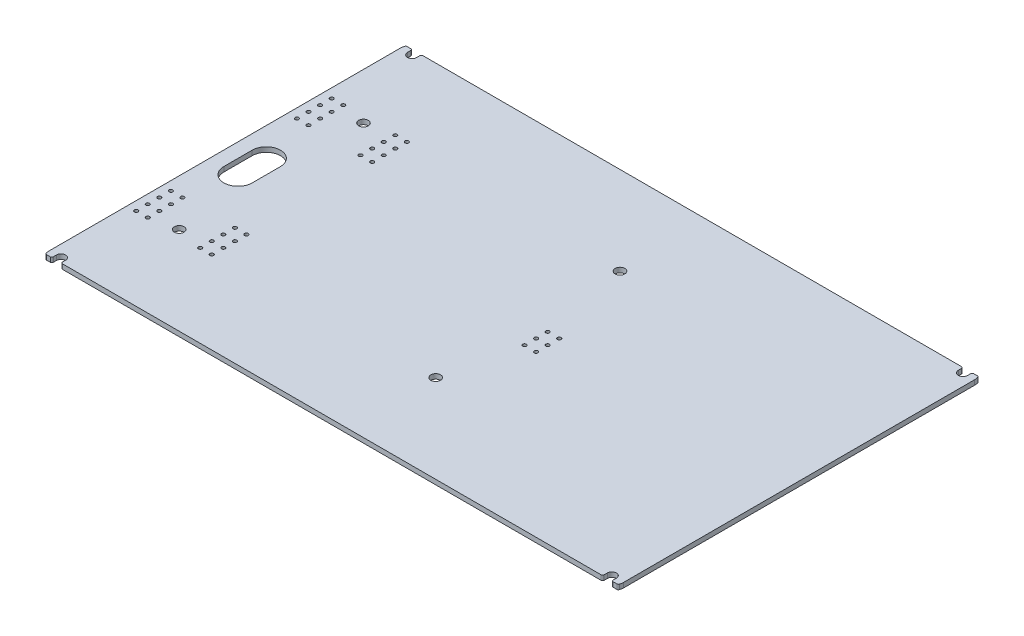
from build123d import *

# Parameters (mm, degrees)
BOSS_EXTRUDE1_DEPTH = 1.5875
SKETCH2_R           = 1.5875
CUT_EXTRUDE1_DEPTH  = 146.836682004
CUT_EXTRUDE2_DEPTH  = 146.836682004
SKETCH7_R           = 0.6
CUT_EXTRUDE3_DEPTH  = 146.836682004
CUT_EXTRUDE4_DEPTH  = 146.836682004
FILLET1_R           = 0.508


with BuildPart() as part:
    # Sketch1 → Boss-Extrude1 (new body)
    with BuildSketch(Plane(origin=(0, 0, 0), x_dir=(1, 0, 0), z_dir=(0, 1, 0))):
        with BuildLine():
            Line((-55.984338917, -57.8231), (-55.984338917, 57.8231))
            ThreePointArc((-55.984338917, 57.8231), (-55.902770541, 58.613831816), (-55.661500758, 59.371261083))
            Line((-55.661500758, 59.371261083), (132.872022924, 59.371261083))
            ThreePointArc((132.872022924, 59.371261083), (133.113292708, 58.613831816), (133.194861083, 57.8231))
            Line((133.194861083, 57.8231), (133.194861083, -57.8231))
            ThreePointArc((133.194861083, -57.8231), (133.113292708, -58.613831816), (132.872022924, -59.371261083))
            Line((132.872022924, -59.371261083), (-55.661500758, -59.371261083))
            ThreePointArc((-55.661500758, -59.371261083), (-55.902770541, -58.613831816), (-55.984338917, -57.8231))
        make_face()
    extrude(amount=-BOSS_EXTRUDE1_DEPTH)

    # Sketch2 → Cut-Extrude1 (cut, through all)
    with BuildSketch(Plane(origin=(0, 0, 0), x_dir=(1, 0, 0), z_dir=(0, 1, 0))):
        with Locations((-40.6725, -30.35)):
            Circle(SKETCH2_R)
        with Locations((-40.6725, 30.35)):
            Circle(SKETCH2_R)
        with Locations((43.8275, 30.35)):
            Circle(SKETCH2_R)
        with Locations((43.8275, -30.35)):
            Circle(SKETCH2_R)
    extrude(amount=-CUT_EXTRUDE1_DEPTH, mode=Mode.SUBTRACT)

    # Sketch3 → Cut-Extrude2 (cut, through all)
    with BuildSketch(Plane(origin=(0, 0, 0), x_dir=(1, 0, 0), z_dir=(0, 1, 0))):
        with BuildLine():
            Line((-41.933471413, 4.284952831), (-41.933471413, -5.034952831))
            ThreePointArc((-41.933471413, -5.034952831), (-46.603471413, -9.704952831), (-51.273471413, -5.034952831))
            Line((-51.273471413, -5.034952831), (-51.273471413, 4.284952831))
            ThreePointArc((-51.273471413, 4.284952831), (-46.603471413, 8.954952831), (-41.933471413, 4.284952831))
        make_face()
    extrude(amount=-CUT_EXTRUDE2_DEPTH, mode=Mode.SUBTRACT)

    # Sketch7 → Cut-Extrude3 (cut, through all)
    with BuildSketch(Plane.XZ.offset(1.5875)):
        with Locations((49.2175, 6.483)):
            Circle(SKETCH7_R)
        with Locations((-49.1085, -32.125)):
            Circle(SKETCH7_R)
        with Locations((-28.1535, -32.125)):
            Circle(SKETCH7_R)
        with Locations((-28.1535, 20.707)):
            Circle(SKETCH7_R)
        with Locations((-49.2355, 20.707)):
            Circle(SKETCH7_R)
        with Locations((-31.9635, 20.707)):
            Circle(SKETCH7_R)
        with Locations((-53.0455, 20.707)):
            Circle(SKETCH7_R)
        with Locations((-31.9635, 28.327)):
            Circle(SKETCH7_R)
        with Locations((-53.0455, 28.327)):
            Circle(SKETCH7_R)
        with Locations((-31.9635, 24.517)):
            Circle(SKETCH7_R)
        with Locations((-53.0455, 24.517)):
            Circle(SKETCH7_R)
        with Locations((-31.9635, -28.315)):
            Circle(SKETCH7_R)
        with Locations((-52.9185, -28.315)):
            Circle(SKETCH7_R)
        with Locations((-31.9635, -32.125)):
            Circle(SKETCH7_R)
        with Locations((-52.9185, -32.125)):
            Circle(SKETCH7_R)
        with Locations((-28.1535, 24.517)):
            Circle(SKETCH7_R)
        with Locations((-49.2355, 24.517)):
            Circle(SKETCH7_R)
        with Locations((-31.9635, 32.137)):
            Circle(SKETCH7_R)
        with Locations((-53.0455, 32.137)):
            Circle(SKETCH7_R)
        with Locations((-31.9635, -20.695)):
            Circle(SKETCH7_R)
        with Locations((-52.9185, -20.695)):
            Circle(SKETCH7_R)
        with Locations((-31.9635, -24.505)):
            Circle(SKETCH7_R)
        with Locations((-52.9185, -24.505)):
            Circle(SKETCH7_R)
        with Locations((-28.1535, 32.137)):
            Circle(SKETCH7_R)
        with Locations((-49.2355, 32.137)):
            Circle(SKETCH7_R)
        with Locations((-28.1535, 28.327)):
            Circle(SKETCH7_R)
        with Locations((-49.2355, 28.327)):
            Circle(SKETCH7_R)
        with Locations((-28.1535, -24.505)):
            Circle(SKETCH7_R)
        with Locations((-49.1085, -24.505)):
            Circle(SKETCH7_R)
        with Locations((-28.1535, -28.315)):
            Circle(SKETCH7_R)
        with Locations((-49.1085, -28.315)):
            Circle(SKETCH7_R)
        with Locations((49.2175, 2.673)):
            Circle(SKETCH7_R)
        with Locations((53.0275, -1.137)):
            Circle(SKETCH7_R)
        with Locations((53.0275, 2.673)):
            Circle(SKETCH7_R)
        with Locations((53.0275, 6.483)):
            Circle(SKETCH7_R)
        with Locations((-28.1535, -20.695)):
            Circle(SKETCH7_R)
        with Locations((-49.1085, -20.695)):
            Circle(SKETCH7_R)
        with Locations((49.2175, -1.137)):
            Circle(SKETCH7_R)
    extrude(amount=-CUT_EXTRUDE3_DEPTH, mode=Mode.SUBTRACT)

    # Sketch9 → Cut-Extrude4 (cut, through all)
    with BuildSketch(Plane(origin=(0, 0, 0), x_dir=(1, 0, 0), z_dir=(0, 1, 0))):
        with BuildLine():
            Line((130.821361083, -57.8231), (130.821361083, -59.371261083))
            Line((130.821361083, -59.371261083), (127.821361083, -59.371261083))
            Line((127.821361083, -59.371261083), (127.821361083, -57.8231))
            ThreePointArc((127.821361083, -57.8231), (129.321361083, -56.3231), (130.821361083, -57.8231))
        make_face()
        with BuildLine():
            Line((127.821361083, 57.8231), (127.821361083, 59.371261083))
            Line((127.821361083, 59.371261083), (130.821361083, 59.371261083))
            Line((130.821361083, 59.371261083), (130.821361083, 57.8231))
            ThreePointArc((130.821361083, 57.8231), (129.321361083, 56.3231), (127.821361083, 57.8231))
        make_face()
        with BuildLine():
            Line((-50.610838917, 57.8231), (-50.610838917, 59.371261083))
            Line((-50.610838917, 59.371261083), (-53.610838917, 59.371261083))
            Line((-53.610838917, 59.371261083), (-53.610838917, 57.8231))
            ThreePointArc((-53.610838917, 57.8231), (-52.110838917, 56.3231), (-50.610838917, 57.8231))
        make_face()
        with BuildLine():
            Line((-53.610838917, -57.8231), (-53.610838917, -59.371261083))
            Line((-53.610838917, -59.371261083), (-50.610838917, -59.371261083))
            Line((-50.610838917, -59.371261083), (-50.610838917, -57.8231))
            ThreePointArc((-50.610838917, -57.8231), (-52.110838917, -56.3231), (-53.610838917, -57.8231))
        make_face()
    extrude(amount=-CUT_EXTRUDE4_DEPTH, mode=Mode.SUBTRACT)

    # Fillet1
    fillet1_edges = [part.edges().sort_by_distance(p)[0] for p in [
        (-50.610838917, -0.79375, 59.371261083),
        (-53.610838917, -0.79375, 59.371261083),
        (-55.661500758, -0.79375, 59.371261083),
        (127.821361083, -0.79375, 59.371261083),
        (130.821361083, -0.79375, 59.371261083),
        (132.872022924, -0.79375, 59.371261083),
        (132.872022924, -0.79375, -59.371261083),
        (130.821361083, -0.79375, -59.371261083),
        (127.821361083, -0.79375, -59.371261083),
        (-55.661500758, -0.79375, -59.371261083),
        (-53.610838917, -0.79375, -59.371261083),
        (-50.610838917, -0.79375, -59.371261083),
    ]]
    fillet(fillet1_edges, radius=FILLET1_R)


solid = part.part
